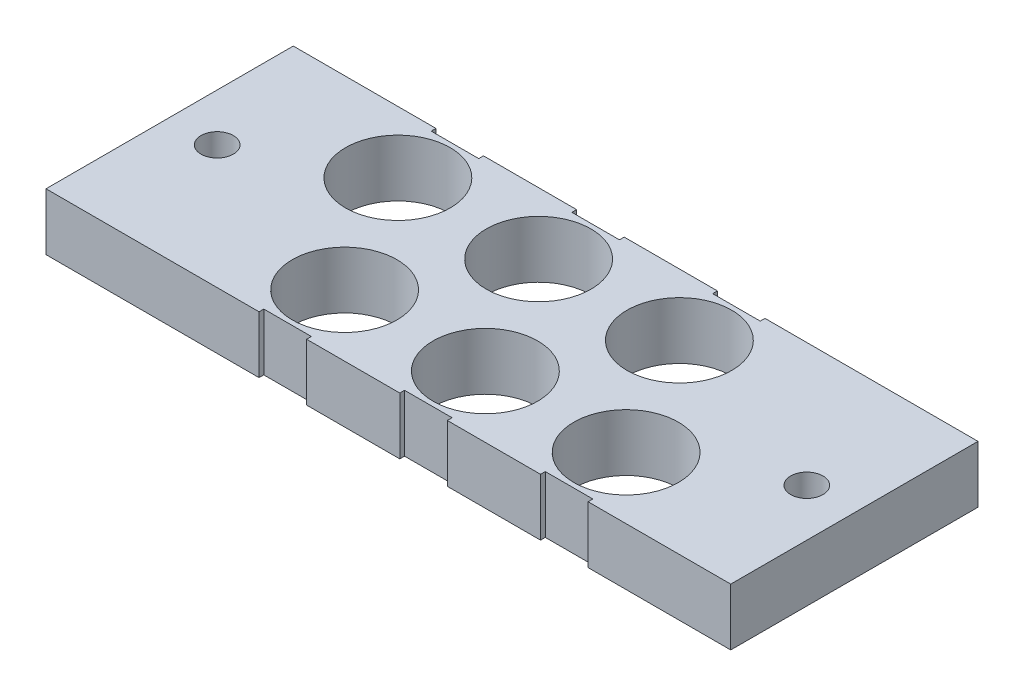
from build123d import *

# Parameters (mm, degrees)
SKETCH1_W               = 12
SKETCH1_H               = 12
SKETCH1_R               = 5.5
BOSS_EXTRUDE1_DEPTH     = 6
BOSS_EXTRUDE1_2_DEPTH   = 6
BOSS_EXTRUDE1_3_DEPTH   = 6
BOSS_EXTRUDE1_4_DEPTH   = 6
BOSS_EXTRUDE1_5_DEPTH   = 6
BOSS_EXTRUDE1_6_DEPTH   = 6
BOSS_EXTRUDE2_START     = -6
BOSS_EXTRUDE2_OUTLINE_R = 1.7
BOSS_EXTRUDE2_DEPTH     = 6
CUT_EXTRUDE1_DEPTH      = 1


# Read off the part's stored shape, not the designer's step: Boss-Extrude2
with BuildPart() as part:
    # Sketch1 → Boss-Extrude1 (new body)
    with BuildSketch(Plane(origin=(0, 0, 0), x_dir=(1, 0, 0), z_dir=(0, 1, 0))):
        with Locations((13.686388819, -10.664882883)):
            Rectangle(SKETCH1_W, SKETCH1_H)
        with Locations(Location((13.686388819, -10.664882883, 0), (0, 0, 270))):
            Circle(SKETCH1_R, mode=Mode.SUBTRACT)
    extrude(amount=-BOSS_EXTRUDE1_DEPTH)



with BuildPart() as body_2:
    # Sketch1 → Boss-Extrude1 2 (new body)
    with BuildSketch(Plane(origin=(0, 0, 0), x_dir=(1, 0, 0), z_dir=(0, 1, 0))):
        with Locations((-1.113611181, -10.664882883)):
            Rectangle(SKETCH1_W, SKETCH1_H)
        with Locations(Location((-1.113611181, -10.664882883, 0), (0, 0, 270))):
            Circle(SKETCH1_R, mode=Mode.SUBTRACT)
    extrude(amount=-BOSS_EXTRUDE1_2_DEPTH)


with BuildPart() as body_3:
    # Sketch1 → Boss-Extrude1 3 (new body)
    with BuildSketch(Plane(origin=(0, 0, 0), x_dir=(1, 0, 0), z_dir=(0, 1, 0))):
        with Locations((6.28638882, -23.664882883)):
            Rectangle(SKETCH1_W, SKETCH1_H)
        with Locations(Location((6.28638882, -23.664882883, 0), (0, 0, 270))):
            Circle(SKETCH1_R, mode=Mode.SUBTRACT)
    extrude(amount=-BOSS_EXTRUDE1_3_DEPTH)


with BuildPart() as body_4:
    # Sketch1 → Boss-Extrude1 4 (new body)
    with BuildSketch(Plane(origin=(0, 0, 0), x_dir=(1, 0, 0), z_dir=(0, 1, 0))):
        with Locations((21.08638882, -23.664882883)):
            Rectangle(SKETCH1_W, SKETCH1_H)
        with Locations(Location((21.08638882, -23.664882883, 0), (0, 0, 270))):
            Circle(SKETCH1_R, mode=Mode.SUBTRACT)
    extrude(amount=-BOSS_EXTRUDE1_4_DEPTH)


with BuildPart() as body_5:
    # Sketch1 → Boss-Extrude1 5 (new body)
    with BuildSketch(Plane(origin=(0, 0, 0), x_dir=(1, 0, 0), z_dir=(0, 1, 0))):
        with Locations((35.88638882, -23.664882883)):
            Rectangle(SKETCH1_W, SKETCH1_H)
        with Locations(Location((35.88638882, -23.664882883, 0), (0, 0, 270))):
            Circle(SKETCH1_R, mode=Mode.SUBTRACT)
    extrude(amount=-BOSS_EXTRUDE1_5_DEPTH)


with BuildPart() as body_6:
    # Sketch1 → Boss-Extrude1 6 (new body)
    with BuildSketch(Plane(origin=(0, 0, 0), x_dir=(1, 0, 0), z_dir=(0, 1, 0))):
        with Locations((28.486388819, -10.664882883)):
            Rectangle(SKETCH1_W, SKETCH1_H)
        with Locations(Location((28.486388819, -10.664882883, 0), (0, 0, 270))):
            Circle(SKETCH1_R, mode=Mode.SUBTRACT)
    extrude(amount=-BOSS_EXTRUDE1_6_DEPTH)


with BuildPart() as part_1:
    add(part.part)

    add(body_2.part)  # Boss-Extrude2 merges body 2

    add(body_3.part)  # Boss-Extrude2 merges body 3

    add(body_4.part)  # Boss-Extrude2 merges body 4

    add(body_5.part)  # Boss-Extrude2 merges body 5

    add(body_6.part)  # Boss-Extrude2 merges body 6
    # Boss-Extrude2 outline → Boss-Extrude2 (add)
    with BuildSketch(Plane(origin=(0, 0, 0), x_dir=(1, 0, 0), z_dir=(0, 1, 0)).offset(BOSS_EXTRUDE2_START)):
        Polygon((11.186388819, -4.164882883), (1.386388819, -4.164882883), (1.386388819, -4.664882883), (4.886388819, -4.664882883), (4.886388819, -16.664882883), (-7.113611181, -16.664882883), (-7.113611181, -4.664882883), (-3.613611181, -4.664882883), (-3.613611181, -4.164882883), (-18.613611181, -4.164883527), (-18.613611181, -30.164882449), (3.78638882, -30.164882883), (3.78638882, -29.664882883), (0.28638882, -29.664882883), (0.28638882, -17.664882883), (12.28638882, -17.664882883), (12.28638882, -29.664882883), (8.78638882, -29.664882883), (8.78638882, -30.164882883), (18.58638882, -30.164882883), (18.58638882, -29.664882883), (15.08638882, -29.664882883), (15.08638882, -17.664882883), (27.08638882, -17.664882883), (27.08638882, -29.664882883), (23.58638882, -29.664882883), (23.58638882, -30.164882883), (33.38638882, -30.164882883), (33.38638882, -29.664882883), (29.88638882, -29.664882883), (29.88638882, -17.664882883), (41.88638882, -17.664882883), (41.88638882, -29.664882883), (38.38638882, -29.664882883), (38.38638882, -30.164882883), (53.38638882, -30.164882883), (53.38638882, -4.164882883), (30.986388819, -4.164882883), (30.986388819, -4.664882883), (34.486388819, -4.664882883), (34.486388819, -16.664882883), (22.486388819, -16.664882883), (22.486388819, -4.664882883), (25.986388819, -4.664882883), (25.986388819, -4.164882883), (16.186388819, -4.164882883), (16.186388819, -4.664882883), (19.686388819, -4.664882883), (19.686388819, -16.664882883), (7.686388819, -16.664882883), (7.686388819, -4.664882883), (11.186388819, -4.664882883), align=None)
        with Locations((-13.613611181, -17.164882988)):
            Circle(BOSS_EXTRUDE2_OUTLINE_R, mode=Mode.SUBTRACT)
        with Locations((48.386388819, -17.164882988)):
            Circle(BOSS_EXTRUDE2_OUTLINE_R, mode=Mode.SUBTRACT)
    extrude(amount=BOSS_EXTRUDE2_DEPTH)

    # Sketch2 → Cut-Extrude1 (cut)
    with BuildSketch(Plane.XZ.offset(6)):
        Polygon((-11.090813446, 25.393846705), (-9.544018575, 25.393846705), (-9.544018575, 25.068205679), (-10.805877549, 25.068205679), (-10.805877549, 24.091282602), (-9.544018575, 24.091282602), (-9.544018575, 23.765641577), (-10.805877549, 23.765641577), (-10.805877549, 22.218846705), (-11.090813446, 22.218846705), align=None)
        with BuildLine():
            Line((-8.852031395, 24.416923628), (-9.136967293, 24.416923628))
            add(Edge.make_bspline(
                [(-9.136967293, 24.416923628), (-9.135110232, 24.454725076), (-9.131463015, 24.528966114), (-9.114383067, 24.637209944), (-9.089943843, 24.74067394), (-9.055389453, 24.838527362), (-9.012475901, 24.931635423), (-8.961013662, 25.019628294), (-8.90005924, 25.102170301), (-8.830928846, 25.178496252), (-8.755845866, 25.248516405), (-8.674832621, 25.308982233), (-8.589701775, 25.360070406), (-8.500711605, 25.402779818), (-8.406858094, 25.434838107), (-8.30899293, 25.45862488), (-8.206686142, 25.472936279), (-8.136981265, 25.474474599), (-8.101530594, 25.475256961)],
                knots=[0, 0, 0, 0, 1.10065271, 2.161652631, 3.183658789, 4.190468796, 5.17591951, 6.163126047, 7.15150782, 8.156236427, 9.156009102, 10.134482811, 11.092018607, 12.041330605, 13.001268258, 13.972401359, 14.968799086, 16, 16, 16, 16], degree=3))
            add(Edge.make_bspline(
                [(-8.101530594, 25.475256961), (-8.066716198, 25.474441933), (-7.998307154, 25.472840431), (-7.898465184, 25.459087212), (-7.803417209, 25.437546568), (-7.713349021, 25.407324726), (-7.628979234, 25.366698853), (-7.549674044, 25.3178968), (-7.474489308, 25.261454524), (-7.406810297, 25.195002851), (-7.344663683, 25.124062116), (-7.291049494, 25.048326661), (-7.245136124, 24.97010438), (-7.206865872, 24.888798797), (-7.178693517, 24.803644364), (-7.157304714, 24.71588083), (-7.145214846, 24.624599752), (-7.143359355, 24.562817376), (-7.142416011, 24.531406801)],
                knots=[0, 0, 0, 0, 1.111607364, 2.184268762, 3.212621178, 4.221274766, 5.211760367, 6.196651075, 7.1921475, 8.207485113, 9.220403448, 10.201281604, 11.166441695, 12.114753415, 13.065576456, 14.026450734, 14.996634279, 16, 16, 16, 16], degree=3))
            add(Edge.make_bspline(
                [(-7.142416011, 24.531406801), (-7.143946038, 24.48718376), (-7.146979244, 24.399513729), (-7.173155489, 24.270514062), (-7.21359782, 24.145414473), (-7.262649782, 24.044740618), (-7.31219844, 23.964025865), (-7.355904397, 23.896973819), (-7.408203317, 23.825466998), (-7.468616685, 23.748785207), (-7.536233124, 23.666693885), (-7.611539287, 23.579159348), (-7.695110449, 23.487111285), (-7.753764656, 23.424241012), (-7.784157797, 23.391663211)],
                knots=[0, 0, 0, 0, 1.184203166, 2.347625244, 3.513805382, 4.700623107, 5.337941753, 6.051866363, 6.845199593, 7.711357327, 8.668078039, 9.695487809, 10.805859518, 12, 12, 12, 12], degree=3))
            Line((-7.784157797, 23.391663211), (-8.578543815, 22.544487731))
            Line((-8.578543815, 22.544487731), (-7.101710882, 22.544487731))
            Line((-7.101710882, 22.544487731), (-7.101710882, 22.218846705))
            Line((-7.101710882, 22.218846705), (-9.259082677, 22.218846705))
            Line((-9.259082677, 22.218846705), (-8.027752549, 23.532859125))
            add(Edge.make_bspline(
                [(-8.027752549, 23.532859125), (-7.997773395, 23.564154017), (-7.940189574, 23.624265101), (-7.858743951, 23.712024786), (-7.785592869, 23.793440441), (-7.720262805, 23.868358238), (-7.664170983, 23.937874018), (-7.614394029, 23.999736356), (-7.574510957, 24.056663607), (-7.531226277, 24.122649736), (-7.489303594, 24.203215195), (-7.453278814, 24.301670756), (-7.431312487, 24.403023335), (-7.428677386, 24.471514469), (-7.427351908, 24.505966096)],
                knots=[0, 0, 0, 0, 1.329631726, 2.553950428, 3.673215718, 4.687767853, 5.603093632, 6.413772471, 7.123043292, 7.734684054, 8.834405432, 9.900288307, 10.943827018, 12, 12, 12, 12], degree=3))
            add(Edge.make_bspline(
                [(-7.427351908, 24.505966096), (-7.427928617, 24.527629936), (-7.4290652, 24.570325205), (-7.439096111, 24.632923286), (-7.454254927, 24.693307081), (-7.475976697, 24.751662329), (-7.504648526, 24.807402313), (-7.539549378, 24.860594884), (-7.579817506, 24.912019874), (-7.626400444, 24.960237509), (-7.677573751, 25.004398317), (-7.731634249, 25.043518023), (-7.7888297, 25.076210645), (-7.848918954, 25.103010817), (-7.911734487, 25.124034199), (-7.977397792, 25.138601624), (-8.045727435, 25.147747878), (-8.092384963, 25.148985376), (-8.116158999, 25.149615936)],
                knots=[0, 0, 0, 0, 0.991446411, 1.95395049, 2.89581595, 3.838931463, 4.798493298, 5.75982156, 6.748411868, 7.785213223, 8.824556874, 9.840280684, 10.836137867, 11.835679398, 12.848801643, 13.863922112, 14.911575587, 16, 16, 16, 16], degree=3))
            add(Edge.make_bspline(
                [(-8.116158999, 25.149615936), (-8.140988255, 25.148967299), (-8.189748813, 25.147693485), (-8.26133965, 25.138782925), (-8.329634605, 25.123410627), (-8.394805474, 25.102386072), (-8.456962527, 25.07566296), (-8.515803481, 25.042378306), (-8.571196245, 25.002660423), (-8.623244948, 24.957629347), (-8.671200129, 24.907493737), (-8.713334081, 24.851604699), (-8.75014958, 24.790982687), (-8.782270813, 24.725791273), (-8.808356332, 24.655438916), (-8.828289118, 24.580175355), (-8.844061472, 24.500327387), (-8.84933063, 24.445186632), (-8.852031395, 24.416923628)],
                knots=[0, 0, 0, 0, 1.031018746, 2.02475058, 2.990194455, 3.934040569, 4.864654155, 5.795059489, 6.735614925, 7.690564532, 8.649604399, 9.611025574, 10.590972636, 11.591080095, 12.624614302, 13.701020113, 14.821632451, 16, 16, 16, 16], degree=3))
        make_face()
    extrude(amount=-CUT_EXTRUDE1_DEPTH, mode=Mode.SUBTRACT)


solid = part_1.part
